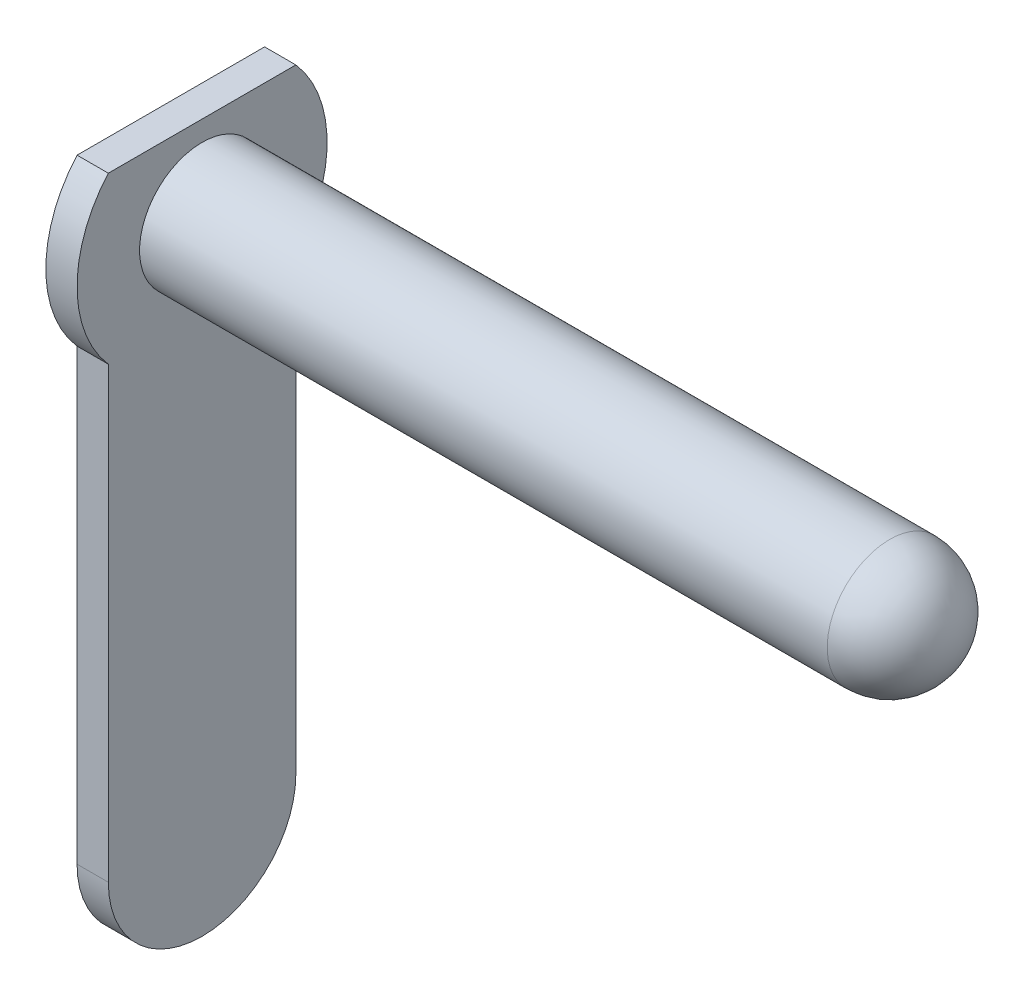
from build123d import *

# Parameters (mm, degrees)
BOSS_EXTRUDE1_DEPTH      = 0.5
BOSS_EXTRUDE2_DEPTH      = 12
BOSS_EXTRUDE2_DEPTH_BACK = 0.6
SKETCH2_R                = 1
FILLET1_R                = 1
SKETCH3_R                = 0.8
CUT_EXTRUDE1_DEPTH       = 0.5
FILLET2_R                = 0.1


with BuildPart() as part:
    # Sketch1 → Boss-Extrude1 (new body)
    with BuildSketch(Plane(origin=(0, 0, 0), x_dir=(0, 0, -1), z_dir=(1, 0, 0))):
        with BuildLine():
            Line((0, 0), (0, 7.177124344))
            ThreePointArc((0, 7.177124344), (-0.5, 8.5), (0, 9.822875656))
            Line((0, 9.822875656), (3, 9.822875656))
            ThreePointArc((3, 9.822875656), (3.5, 8.5), (3, 7.177124344))
            Line((3, 7.177124344), (3, 0))
            ThreePointArc((3, 0), (1.5, -1.5), (0, 0))
        make_face()
    extrude(amount=BOSS_EXTRUDE1_DEPTH)

    # Sketch2 → Boss-Extrude2 (add, two sides: drawn at the far end of the back side and taken through both)
    with BuildSketch(Plane(origin=(0.5, 0, 0), x_dir=(0, 0, -1), z_dir=(1, 0, 0)).offset(-BOSS_EXTRUDE2_DEPTH_BACK)):
        with Locations((1.5, 8.5)):
            Circle(SKETCH2_R)
    extrude(amount=BOSS_EXTRUDE2_DEPTH + BOSS_EXTRUDE2_DEPTH_BACK)

    # Fillet1
    fillet1_edges = [part.edges().sort_by_distance(p)[0] for p in [
        (12.5, 8.5, -0.5),
    ]]
    fillet(fillet1_edges, radius=FILLET1_R)

    # Sketch3 → Cut-Extrude1 (cut)
    with BuildSketch(Plane.ZY.offset(0.1)):
        with Locations((-1.5, 8.5)):
            Circle(SKETCH3_R)
    extrude(amount=-CUT_EXTRUDE1_DEPTH, mode=Mode.SUBTRACT)

    # Fillet2
    fillet2_edges = [part.edges().sort_by_distance(p)[0] for p in [
        (-0.1, 8.5, -0.5),
        (0.4, 8.5, -2.3),
        (-0.1, 8.5, -2.3),
    ]]
    fillet(fillet2_edges, radius=FILLET2_R - 0.0001)  # a hair under: the kernel refuses the full size


solid = part.part
